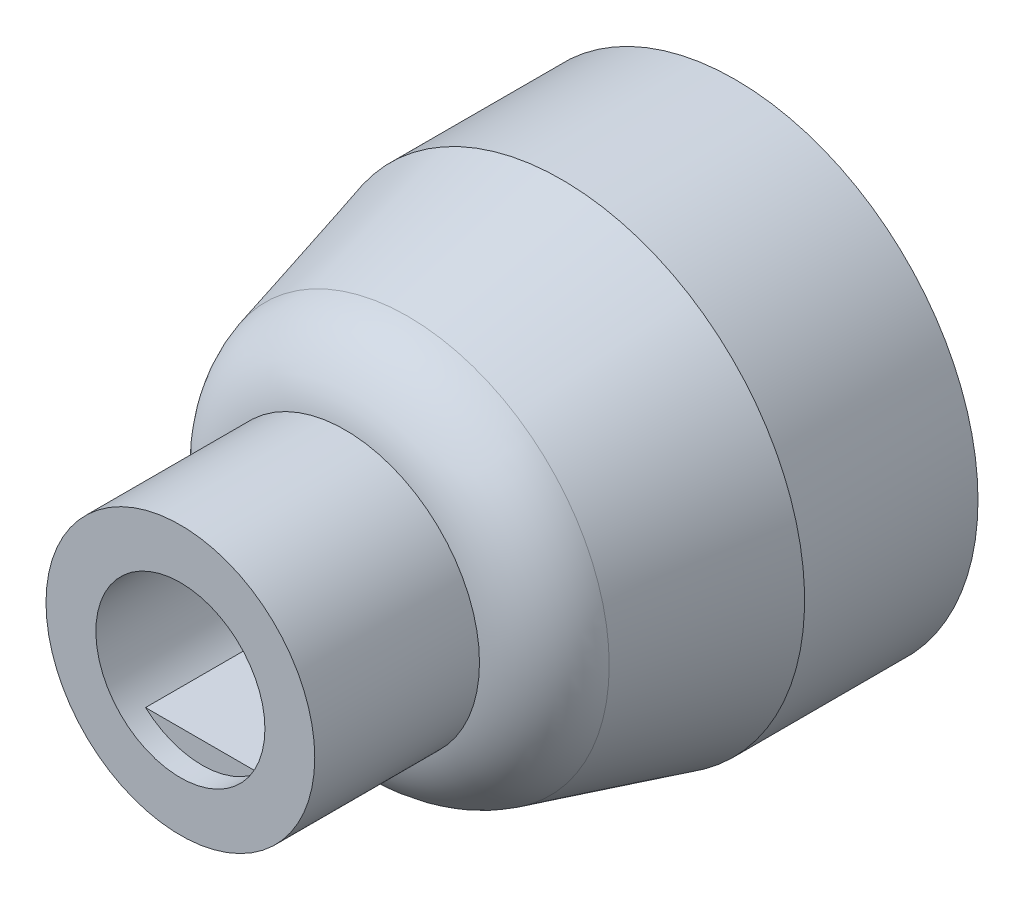
from build123d import *

# Parameters (mm, degrees)
SKETCH1_R           = 5.6
BOSS_EXTRUDE1_DEPTH = 9
SKETCH2_R           = 3.1
BOSS_EXTRUDE2_DEPTH = 3.8
CUT_EXTRUDE1_START  = -0.5
SKETCH3_R           = 1.95
CUT_EXTRUDE1_DEPTH  = 0.5
CHAMFER1_SIZE       = 5
CHAMFER1_SIZE2      = 1.339745962
FILLET1_R           = 2


with BuildPart() as part:
    # Sketch1 → Boss-Extrude1 (new body)
    with BuildSketch(Plane.XY):
        Circle(SKETCH1_R)
    extrude(amount=BOSS_EXTRUDE1_DEPTH)

    # Sketch2 → Boss-Extrude2 (add)
    with BuildSketch(Plane.XY.offset(9)):
        with Locations(Location((0, 0, 0), (0, 0, 180))):
            Circle(SKETCH2_R)
        with BuildLine():
            Line((-1.303840481, -1.45), (1.303840481, -1.45))
            ThreePointArc((1.303840481, -1.45), (1.95, 0), (1.303840481, 1.45))
            Line((1.303840481, 1.45), (-1.303840481, 1.45))
            ThreePointArc((-1.303840481, 1.45), (-1.95, 0), (-1.303840481, -1.45))
        make_face(mode=Mode.SUBTRACT)
    extrude(amount=BOSS_EXTRUDE2_DEPTH)

    # Sketch3 → Cut-Extrude1 (cut)
    with BuildSketch(Plane.XY.offset(12.8).offset(CUT_EXTRUDE1_START)):
        with Locations(Location((0, 0, 0), (0, 0, 131.961888828))):
            Circle(SKETCH3_R)
    extrude(amount=CUT_EXTRUDE1_DEPTH, mode=Mode.SUBTRACT)

    # Chamfer1
    chamfer1_edges = [part.edges().sort_by_distance(p)[0] for p in [
        (-5.6, 0, 9),
    ]]
    chamfer1_side = [part.faces().sort_by_distance(p)[0] for p in [
        (-5.6, 0, 4.5),
    ]]
    chamfer(chamfer1_edges, length=CHAMFER1_SIZE, length2=CHAMFER1_SIZE2, reference=chamfer1_side[0])

    # Fillet1
    # the kernel refuses this fillet: 2 mm, written as the material it takes off along each edge
    with BuildSketch(Plane(origin=(0, 0, 9), x_dir=(1, 0, 0), z_dir=(0, -1, 0))) as fillet1_piece_1:
        with BuildLine():
            CenterArc((2.715609132, -1.962713341), FILLET1_R, 15, 63.919064975)
            Line((3.1, 0), (3.107687817, 0.039254267))
            ThreePointArc((3.107687817, 0.039254267), (3.680127019, 0.04), (4.260254038, 0.04))
            Line((4.260254038, 0.04), (4.298891071, 0.010352762))
            Line((4.298891071, 0.010352762), (4.686097817, -1.434722489))
            Line((4.686097817, -1.434722489), (4.647460784, -1.445075251))
        make_face()
    revolve(axis=Axis((0, 0, 9), (0, 0, 1)), mode=Mode.SUBTRACT)


solid = part.part
